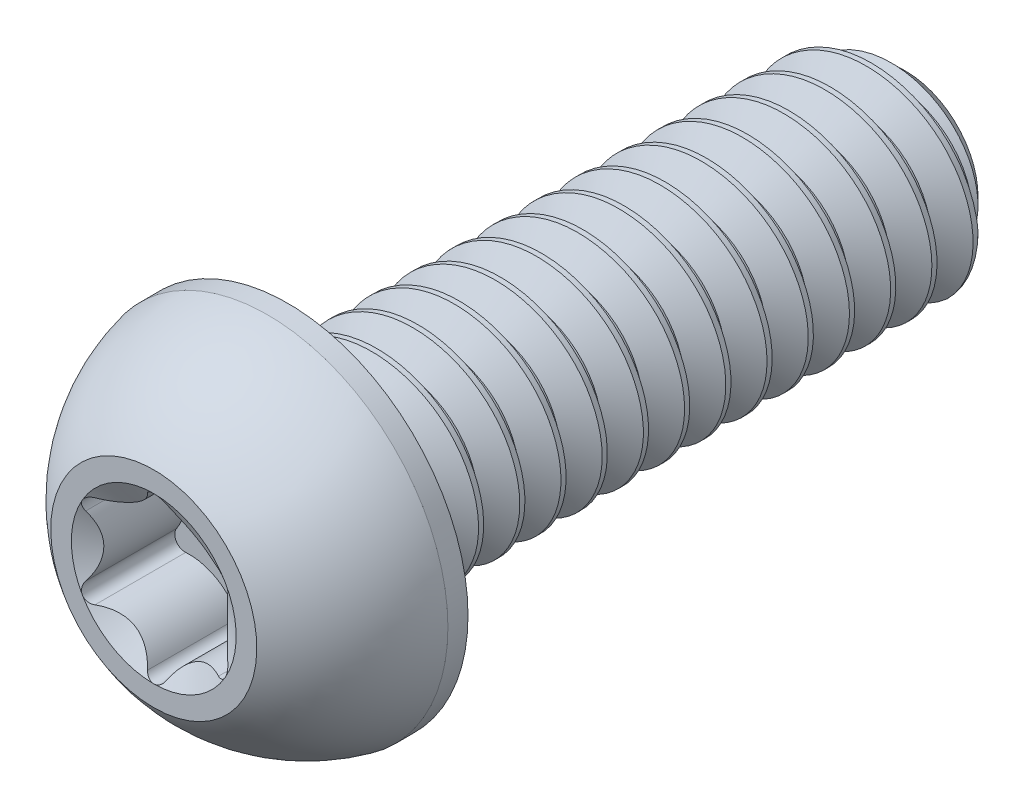
from build123d import *

# Parameters (mm, degrees)
SKETCH1_W          = 6
SKETCH1_H          = 1
CHAMFER1_SIZE      = 0.3
CUT_SWEEP1_PITCH   = 0.4
CUT_EXTRUDE4_DEPTH = 0.91
CIRPATTERN1_COUNT  = 6


with BuildPart() as part:
    # Sketch1 → Revolve1 (revolve)
    with BuildSketch(Plane(origin=(0, 0, 0), x_dir=(0, 0, -1), z_dir=(1, 0, 0))):
        with Locations((4.3, 0.5)):
            Rectangle(SKETCH1_W, SKETCH1_H)
    revolve(axis=Axis((0, 0, -7.3), (0, 0, 1)))

    # Chamfer1
    chamfer1_edges = [part.edges().sort_by_distance(p)[0] for p in [
        (0, -1, -7.3),
    ]]
    chamfer(chamfer1_edges, length=CHAMFER1_SIZE)

    # Cut-Sweep1: the profile of Sketch2 profile screwed along a right-hand helix of 16 turns, 6 arcs to a turn; built about Z, then put on its axis
    cut_sweep1_z = Axis((0, 0, 0), (0, 0, 1))
    cut_sweep1_corners = [(1.0003, 0, 0.000173205), (1.0003, 0, -0.350173205), (0.740192379, 0, -0.2), (0.740192379, 0, -0.15)]
    with BuildLine(mode=Mode.PRIVATE) as cut_sweep1_profile:
        Line(cut_sweep1_corners[0], cut_sweep1_corners[1])
        Line(cut_sweep1_corners[1], cut_sweep1_corners[2])
        Line(cut_sweep1_corners[2], cut_sweep1_corners[3])
        Line(cut_sweep1_corners[3], cut_sweep1_corners[0])
    cut_sweep1_cap = Face(cut_sweep1_profile.wire())
    cut_sweep1_turn_angles = [0, 30, 60, 90, 120, 150, 180, 210, 240, 270, 300, 330, 360]
    cut_sweep1_turn_weights = [1, 0.8660254037844387, 1, 0.8660254037844387, 1, 0.8660254037844387, 1, 0.8660254037844387, 1, 0.8660254037844387, 1, 0.8660254037844387, 1]
    cut_sweep1_turn_rails = [Edge.make_bspline([Vector(p[0], p[1], 0).rotate(cut_sweep1_z, cut_sweep1_turn_angles[k]) / cut_sweep1_turn_weights[k] + Vector(0, 0, p[2] + CUT_SWEEP1_PITCH * cut_sweep1_turn_angles[k] / 360) for k in range(13)], [0, 0, 0, 1, 1, 2, 2, 3, 3, 4, 4, 5, 5, 6, 6, 6], 2, cut_sweep1_turn_weights) for p in cut_sweep1_corners]
    cut_sweep1_turn_sides = [Face.make_surface_from_curves(cut_sweep1_turn_rails[p[0]], cut_sweep1_turn_rails[p[1]]) for p in [(0, 1), (1, 2), (2, 3), (3, 0)]]
    cut_sweep1 = Plane(origin=(0, 0, -7.3), x_dir=(0, 1, 0), z_dir=(0, 0, 1)) * Solid(Shell([*[p.moved(Location((0, 0, CUT_SWEEP1_PITCH * i))) for i in range(16) for p in cut_sweep1_turn_sides], cut_sweep1_cap, cut_sweep1_cap.rotate(cut_sweep1_z, 5760).moved(Location((0, 0, CUT_SWEEP1_PITCH * 5760 / 360)))]))
    add(cut_sweep1, mode=Mode.SUBTRACT)

    # Sketch7 → Revolve2 (revolve)
    with BuildSketch(Plane(origin=(0, 0, 0), x_dir=(0, 0, -1), z_dir=(1, 0, 0)), mode=Mode.PRIVATE) as revolve2_sk:
        with BuildLine():
            Line((1.105, 1.75), (1.3, 1.75))
            Line((1.3, 1.75), (1.3, 0))
            Line((1.3, 0), (0, 0))
            Line((0, 0), (0, 1))
            ThreePointArc((0, 1), (0.479976957, 1.481850617), (1.105, 1.75))
        make_face()
    revolve(revolve2_sk.sketch.rotate(Axis((0, 0, 0), (0, 0, -1)), 189.336081704), axis=Axis((0, 0, 0), (0, 0, -1)))

    # Sketch11 → Cut-Extrude4 (cut)
    with BuildSketch(Plane.XY):
        with BuildLine():
            Line((0, 0), (-0.692820323, 0.4))
            ThreePointArc((-0.692820323, 0.4), (-0.706163843, 0.346715947), (-0.68935124, 0.294422772))
            ThreePointArc((-0.68935124, 0.294422772), (-0.6, 0), (-0.68935124, -0.294422772))
            ThreePointArc((-0.68935124, -0.294422772), (-0.706163843, -0.346715947), (-0.692820323, -0.4))
            Line((-0.692820323, -0.4), (0, 0))
        make_face()
    cut_extrude4 = extrude(amount=-CUT_EXTRUDE4_DEPTH, mode=Mode.SUBTRACT)

    # CirPattern1: Cut-Extrude4 ×6 about axis
    cirpattern1_axis = Axis((0, 0, 0), (0, 0, 1))
    for i in range(1, CIRPATTERN1_COUNT):
        add(cut_extrude4.rotate(cirpattern1_axis, i * 360 / CIRPATTERN1_COUNT), mode=Mode.SUBTRACT)

    # Cut-Extrude3 cone 1 section (through the dimple's axis) → Cut-Extrude3 (revolve, cut)
    with BuildSketch(Plane(origin=(0, 0, 0), x_dir=(0, -1, 0), z_dir=(1, 0, 0))):
        Polygon((0, 0), (0.8, 0), (0, 0.461880215), align=None)
    revolve(axis=Axis((0, 0, 0), (0, 0, -1)), mode=Mode.SUBTRACT)


solid = part.part
